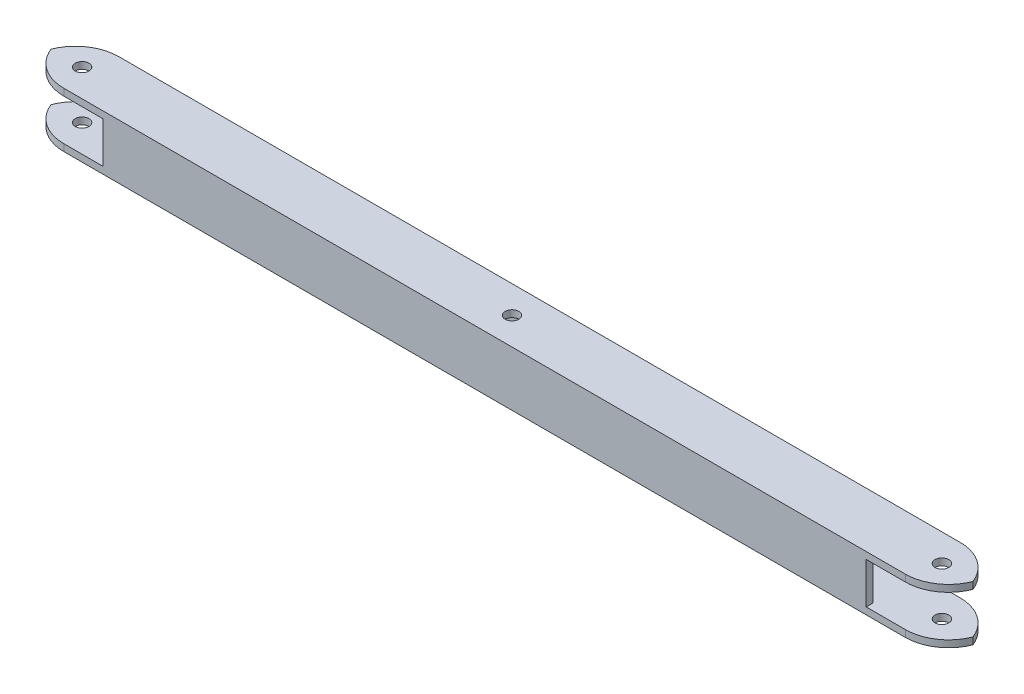
from build123d import *

# Parameters (mm, degrees)
SKETCH1_W           = 429.48
SKETCH1_H           = 25.4
SKETCH1_R           = 3.175
BOSS_EXTRUDE1_DEPTH = 25.4
CUT_EXTRUDE1_REACH  = 432.98
SKETCH2_W           = 19.05
SKETCH2_H           = 19.05
SKETCH4_W           = 25.4
SKETCH4_H           = 19.05
CUT_EXTRUDE2_DEPTH  = 38.1
FILLET1_R           = 20


with BuildPart() as part:
    # Sketch1 → Boss-Extrude1 (new body)
    with BuildSketch(Plane(origin=(0, 0, 0), x_dir=(1, 0, 0), z_dir=(0, 1, 0))):
        with Locations((214.74, -12.7)):
            Rectangle(SKETCH1_W, SKETCH1_H)
        with Locations(Location((214.74, -12.7, 0), (0, 0, 270))):
            Circle(SKETCH1_R, mode=Mode.SUBTRACT)
        with Locations(Location((15.76, -12.7, 0), (0, 0, 270))):
            Circle(SKETCH1_R, mode=Mode.SUBTRACT)
        with Locations(Location((413.72, -12.7, 0), (0, 0, 90))):
            Circle(SKETCH1_R, mode=Mode.SUBTRACT)
    extrude(amount=BOSS_EXTRUDE1_DEPTH)

    # Cut-Extrude1: up to this face of the body (flat: up to its plane)
    cut_extrude1_end = Plane(part.part.faces().sort_by_distance((429.48, 12.7, 12.7))[0])
    # Sketch2 → Cut-Extrude1 (cut, up to the picked face)
    with BuildSketch(Plane.ZY, mode=Mode.PRIVATE) as cut_extrude1_sk1:
        with Locations((12.7, 12.7)):
            Rectangle(SKETCH2_W, SKETCH2_H)
    cut_extrude1_tool1 = split(extrude(cut_extrude1_sk1.sketch, amount=-CUT_EXTRUDE1_REACH, mode=Mode.PRIVATE), bisect_by=cut_extrude1_end, keep=Keep.BOTH, mode=Mode.PRIVATE)
    add(cut_extrude1_tool1.solids().sort_by(Axis((0, 12.7, 12.7), (1, 0, 0)))[0], mode=Mode.SUBTRACT)

    # Sketch4 → Cut-Extrude2 (cut)
    with BuildSketch(Plane.ZY):
        with Locations((12.7, 12.7)):
            Rectangle(SKETCH4_W, SKETCH4_H)
    cut_extrude2 = extrude(amount=-CUT_EXTRUDE2_DEPTH, mode=Mode.SUBTRACT)

    # Mirror1: Cut-Extrude2 across plane
    add(cut_extrude2.mirror(Plane.ZY.offset(-214.74)), mode=Mode.SUBTRACT)

    # Fillet1
    # the kernel refuses this fillet: 20 mm, written as the material it takes off along each edge
    with BuildSketch(Plane(origin=(429.48, -50, 0), x_dir=(-1, 0, 0), z_dir=(0, 1, 0)), Plane(origin=(429.48, -27.775, 0), x_dir=(-1, 0, 0), z_dir=(0, 1, 0)), Plane(origin=(0, -27.775, 25.4), x_dir=(1, 0, 0), z_dir=(0, 1, 0))) as fillet1_piece_1:
        with BuildLine():
            CenterArc((FILLET1_R, FILLET1_R), FILLET1_R, 180, 90)
            Line((0, FILLET1_R), (0, 0))
            Line((0, 0), (FILLET1_R, 0))
        make_face()
    extrude(amount=103.175, mode=Mode.SUBTRACT)
    with BuildSketch(Plane(origin=(429.48, -50, 25.4), x_dir=(-1, 0, 0), z_dir=(0, 1, 0)), Plane(origin=(429.48, -27.775, 25.4), x_dir=(-1, 0, 0), z_dir=(0, 1, 0)), Plane(origin=(0, -50, 25.4), x_dir=(0, 0, -1), z_dir=(0, 1, 0)), Plane(origin=(0, -50, 0), x_dir=(1, 0, 0), z_dir=(0, 1, 0)), Plane(origin=(0, -27.775, 0), x_dir=(1, 0, 0), z_dir=(0, 1, 0))) as fillet1_piece_2:
        with BuildLine():
            CenterArc((FILLET1_R, -FILLET1_R), FILLET1_R, 90, 90)
            Line((0, -FILLET1_R), (0, 0))
            Line((0, 0), (FILLET1_R, 0))
        make_face()
    extrude(amount=103.175, mode=Mode.SUBTRACT)


solid = part.part
